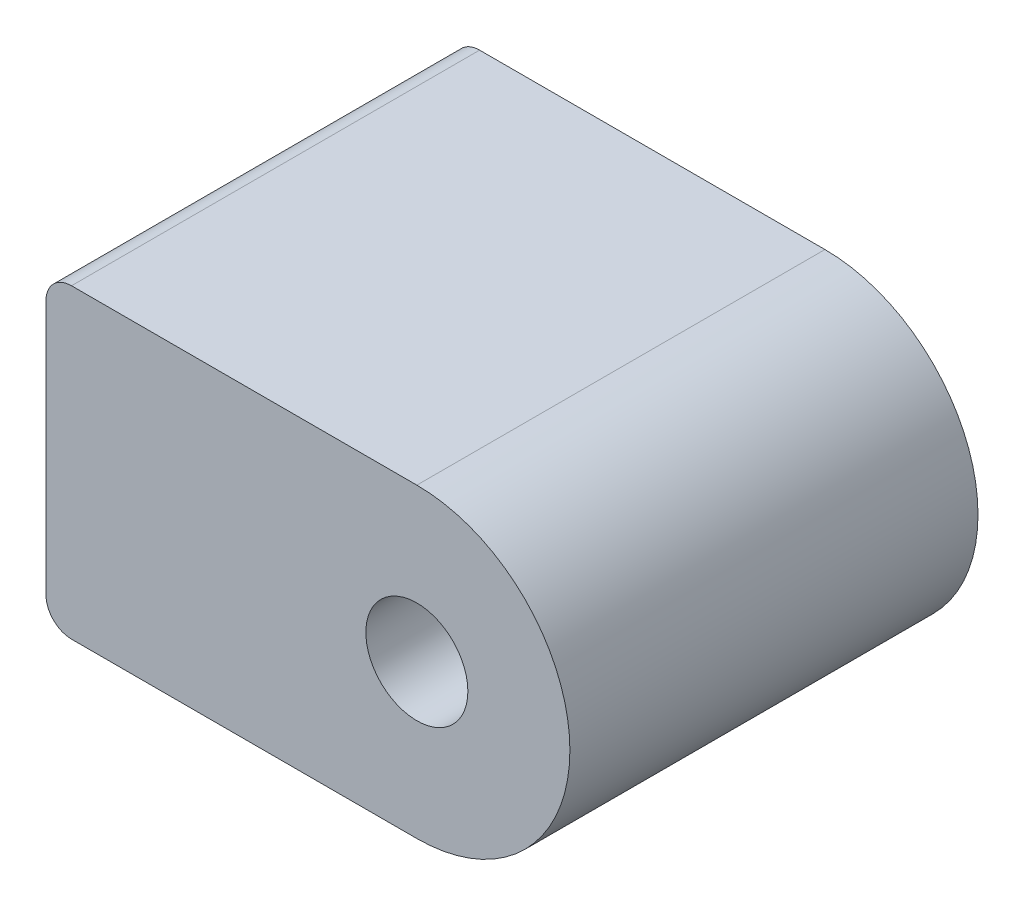
from build123d import *

# Parameters (mm, degrees)
SKETCH1_R           = 1
BOSS_EXTRUDE1_DEPTH = 8
CUT_EXTRUDE1_START  = -0.4
SKETCH2_R           = 2.65
CUT_EXTRUDE1_DEPTH  = 3.3
FILLET2_R           = 0.5


with BuildPart() as part:
    # Sketch1 → Boss-Extrude1 (new body)
    with BuildSketch(Plane.XY):
        with BuildLine():
            Line((0, 3), (-7.27, 3))
            Line((-7.27, 3), (-7.27, -3))
            Line((-7.27, -3), (0, -3))
            ThreePointArc((0, -3), (3, 0), (0, 3))
        make_face()
        Circle(SKETCH1_R, mode=Mode.SUBTRACT)
    extrude(amount=BOSS_EXTRUDE1_DEPTH)

    # Sketch2 → Cut-Extrude1 (cut)
    with BuildSketch(Plane.ZY.offset(7.27).offset(CUT_EXTRUDE1_START)):
        with Locations((4, 0)):
            Circle(SKETCH2_R)
    extrude(amount=-CUT_EXTRUDE1_DEPTH, mode=Mode.SUBTRACT)

    # Fillet2
    fillet2_edges = [part.edges().sort_by_distance(p)[0] for p in [
        (-7.27, -3, 4),
        (-7.27, 3, 4),
    ]]
    fillet(fillet2_edges, radius=FILLET2_R)


solid = part.part
